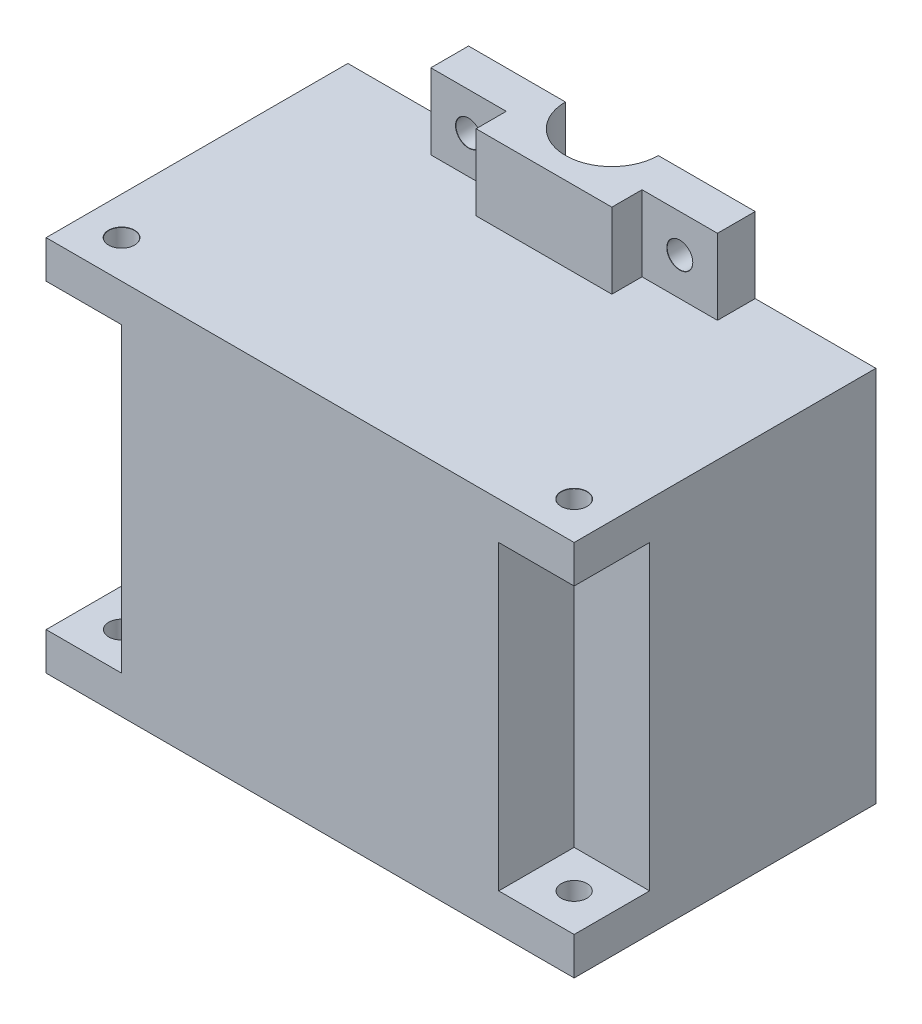
from build123d import *

# Parameters (mm, degrees)
SKETCH_1_W                 = 70
SKETCH_1_H                 = 50
EXTRUDE_1_DEPTH            = 40
EXTRUDE_2_DEPTH            = 10
EXTRUDE_2_DEPTH_BACK       = 60
CUT_EXTRUDE_1_REACH        = 108.771
SKETCH_7_W                 = 10
SKETCH_7_H                 = 40
CUT_EXTRUDE_2_DEPTH        = 10
HOLE_WIZARD_M3_2_OUTLINE_R = 1.7
HOLE_WIZARD_M3_2_DEPTH     = 5


# Read off the part's stored shape, not the designer's step: M3 すきま穴1, M3 すきま穴2
with BuildPart() as part:
    # ｽｹｯﾁ1 → ﾎﾞｽ - 押し出し1 (new body)
    with BuildSketch(Plane.XY):
        with Locations((35, 25)):
            Rectangle(SKETCH_1_W, SKETCH_1_H)
    extrude(amount=EXTRUDE_1_DEPTH)

    # ｽｹｯﾁ2 → ﾎﾞｽ - 押し出し2 (add, two sides: drawn at the far end of the back side and taken through both)
    with BuildSketch(Plane(origin=(0, 50, 0), x_dir=(1, 0, 0), z_dir=(0, 1, 0)).offset(-EXTRUDE_2_DEPTH_BACK)):
        Polygon((16, 0), (16, -5), (26, -5), (26, -9), (44, -9), (44, -5), (54, -5), (54, 0), align=None)
    extrude(amount=EXTRUDE_2_DEPTH + EXTRUDE_2_DEPTH_BACK)

    # M3 すきま穴1 outline → M3 すきま穴1 (revolve, cut)
    with BuildSketch(Plane(origin=(49, -5, 0), x_dir=(1, 0, 0), z_dir=(0, -1, 0))):
        Polygon((0, 0), (1.7, 0), (1.7, 4.97124079), (1.725, 5), (0, 5), align=None)
    revolve(axis=Axis((49, -5, 0), (0, 0, 1)), mode=Mode.SUBTRACT)

    # Hole Wizard M3 _1 2 outline → Hole Wizard M3 _1 2 (revolve, cut)
    with BuildSketch(Plane(origin=(21, -5, 0), x_dir=(1, 0, 0), z_dir=(0, -1, 0))):
        Polygon((0, 0), (1.7, 0), (1.7, 4.97124079), (1.725, 5), (0, 5), align=None)
    revolve(axis=Axis((21, -5, 0), (0, 0, 1)), mode=Mode.SUBTRACT)

    # Hole Wizard M3 _1 3 outline → Hole Wizard M3 _1 3 (revolve, cut)
    with BuildSketch(Plane(origin=(49, 55, 0), x_dir=(1, 0, 0), z_dir=(0, -1, 0))):
        Polygon((0, 0), (1.7, 0), (1.7, 4.97124079), (1.725, 5), (0, 5), align=None)
    revolve(axis=Axis((49, 55, 0), (0, 0, 1)), mode=Mode.SUBTRACT)

    # Hole Wizard M3 _1 4 outline → Hole Wizard M3 _1 4 (revolve, cut)
    with BuildSketch(Plane(origin=(21, 55, 0), x_dir=(1, 0, 0), z_dir=(0, -1, 0))):
        Polygon((0, 0), (1.7, 0), (1.7, 4.97124079), (1.725, 5), (0, 5), align=None)
    revolve(axis=Axis((21, 55, 0), (0, 0, 1)), mode=Mode.SUBTRACT)

    # ｽｹｯﾁ6 → ｶｯﾄ - 押し出し1 (cut, up to next)
    with BuildSketch(Plane(origin=(0, 60, 0), x_dir=(1, 0, 0), z_dir=(0, 1, 0)), mode=Mode.PRIVATE) as cut_extrude_1_sk1:
        with BuildLine():
            Line((28.85, 0), (41.15, 0))
            ThreePointArc((41.15, 0), (35, -6.15), (28.85, 0))
        make_face()
    cut_extrude_1_tool1 = extrude(cut_extrude_1_sk1.sketch, amount=-CUT_EXTRUDE_1_REACH, mode=Mode.PRIVATE) & part.part
    add(cut_extrude_1_tool1.solids().sort_by_distance((35, 60, 2.610141))[0], mode=Mode.SUBTRACT)

    # ｽｹｯﾁ7 → ｶｯﾄ - 押し出し2 (cut)
    with BuildSketch(Plane(origin=(70, 0, 0), x_dir=(0, 0, -1), z_dir=(1, 0, 0))):
        with Locations((-35, 25)):
            Rectangle(SKETCH_7_W, SKETCH_7_H)
    cut_extrude_2 = extrude(amount=-CUT_EXTRUDE_2_DEPTH, mode=Mode.SUBTRACT)

    # ﾐﾗｰ1: ｶｯﾄ - 押し出し2 across plane
    add(cut_extrude_2.mirror(Plane.ZY.offset(-35)), mode=Mode.SUBTRACT)

    # M3 すきま穴2 outline → M3 すきま穴2 (cut)
    with BuildSketch(Plane(origin=(0, 0, 0), x_dir=(1, 0, 0), z_dir=(0, 1, 0))):
        with Locations((65, -35)):
            Circle(HOLE_WIZARD_M3_2_OUTLINE_R)
        with Locations((5, -35)):
            Circle(HOLE_WIZARD_M3_2_OUTLINE_R)
    extrude(amount=HOLE_WIZARD_M3_2_DEPTH, mode=Mode.SUBTRACT)

    # Hole Wizard M3 _2 2 outline → Hole Wizard M3 _2 2 (revolve, cut)
    with BuildSketch(Plane(origin=(65, 0, 35), x_dir=(1, 0, 0), z_dir=(0, 0, 1))):
        Polygon((1.725, 50), (0, 50), (0, 45), (1.7, 45), (1.7, 49.97124079), align=None)
    revolve(axis=Axis((65, 0, 35), (0, 1, 0)), mode=Mode.SUBTRACT)

    # Hole Wizard M3 _2 3 outline → Hole Wizard M3 _2 3 (revolve, cut)
    with BuildSketch(Plane(origin=(5, 0, 35), x_dir=(1, 0, 0), z_dir=(0, 0, 1))):
        Polygon((0, 45), (1.7, 45), (1.7, 49.97124079), (1.725, 50), (0, 50), align=None)
    revolve(axis=Axis((5, 0, 35), (0, 1, 0)), mode=Mode.SUBTRACT)


solid = part.part
